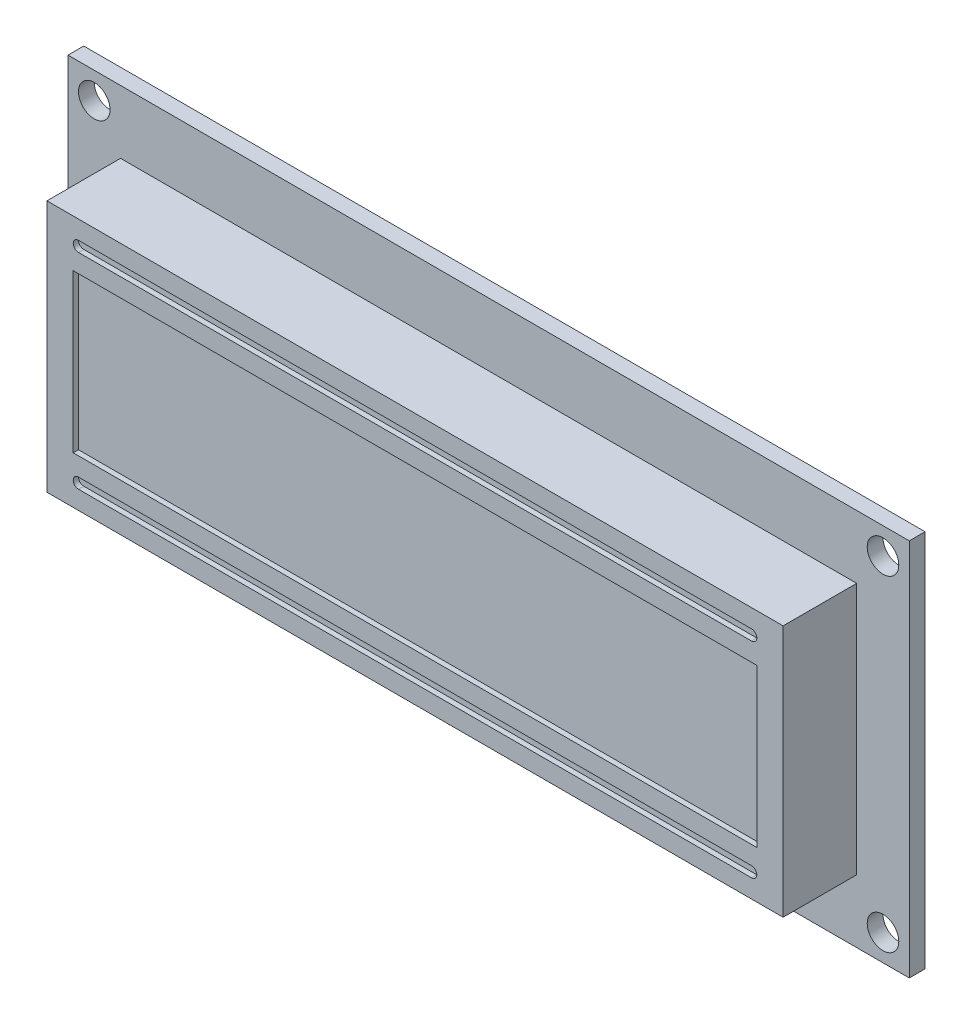
from build123d import *

# Parameters (mm, degrees)
SKETCH1_W           = 80
SKETCH1_H           = 36
BASE_FLANGE1_DEPTH  = 1.5
SKETCH6_W           = 70
SKETCH6_H           = 24
BOSS_EXTRUDE1_DEPTH = 7
SKETCH7_W           = 65
SKETCH7_H           = 15
CUT_EXTRUDE1_DEPTH  = 0.5
CUT_EXTRUDE2_DEPTH  = 0.5
CUT_EXTRUDE3_REACH  = 46.679
SKETCH9_R           = 1.5


# Sheet-metal steps are written as plain solids
with BuildPart() as part:
    # Sketch1 → Base-Flange1 (new body)
    with BuildSketch(Plane.XY):
        Rectangle(SKETCH1_W, SKETCH1_H)
    extrude(amount=-BASE_FLANGE1_DEPTH)

    # Sketch6 → Boss-Extrude1 (add)
    with BuildSketch(Plane.XY):
        Rectangle(SKETCH6_W, SKETCH6_H)
    extrude(amount=BOSS_EXTRUDE1_DEPTH)

    # Sketch7 → Cut-Extrude1 (cut)
    with BuildSketch(Plane.XY.offset(7)):
        Rectangle(SKETCH7_W, SKETCH7_H)
    extrude(amount=-CUT_EXTRUDE1_DEPTH, mode=Mode.SUBTRACT)

    # Sketch8 → Cut-Extrude2 (cut)
    with BuildSketch(Plane.XY.offset(7)):
        with BuildLine():
            Line((32, 9.25), (-32, 9.25))
            ThreePointArc((-32, 9.25), (-32.5, 9.75), (-32, 10.25))
            Line((-32, 10.25), (32, 10.25))
            ThreePointArc((32, 10.25), (32.5, 9.75), (32, 9.25))
        make_face()
        with BuildLine():
            Line((32, -9.25), (-32, -9.25))
            ThreePointArc((-32, -9.25), (-32.5, -9.75), (-32, -10.25))
            Line((-32, -10.25), (32, -10.25))
            ThreePointArc((32, -10.25), (32.5, -9.75), (32, -9.25))
        make_face()
    extrude(amount=-CUT_EXTRUDE2_DEPTH, mode=Mode.SUBTRACT)

    # Sketch9 → Cut-Extrude3 (cut, up to next)
    with BuildSketch(Plane(origin=(0, 0, -1.5), x_dir=(-1, 0, 0), z_dir=(0, 0, -1)), mode=Mode.PRIVATE) as cut_extrude3_sk1:
        with Locations((-37.5, 15.5)):
            Circle(SKETCH9_R)
    cut_extrude3_tool1 = extrude(cut_extrude3_sk1.sketch, amount=-CUT_EXTRUDE3_REACH, mode=Mode.PRIVATE) & part.part
    # Sketch9 → Cut-Extrude3 (cut, up to next)
    with BuildSketch(Plane(origin=(0, 0, -1.5), x_dir=(-1, 0, 0), z_dir=(0, 0, -1)), mode=Mode.PRIVATE) as cut_extrude3_sk2:
        with Locations((-37.5, -15.5)):
            Circle(SKETCH9_R)
    cut_extrude3_tool2 = extrude(cut_extrude3_sk2.sketch, amount=-CUT_EXTRUDE3_REACH, mode=Mode.PRIVATE) & part.part
    # Sketch9 → Cut-Extrude3 (cut, up to next)
    with BuildSketch(Plane(origin=(0, 0, -1.5), x_dir=(-1, 0, 0), z_dir=(0, 0, -1)), mode=Mode.PRIVATE) as cut_extrude3_sk3:
        with Locations((37.5, 15.5)):
            Circle(SKETCH9_R)
    cut_extrude3_tool3 = extrude(cut_extrude3_sk3.sketch, amount=-CUT_EXTRUDE3_REACH, mode=Mode.PRIVATE) & part.part
    # Sketch9 → Cut-Extrude3 (cut, up to next)
    with BuildSketch(Plane(origin=(0, 0, -1.5), x_dir=(-1, 0, 0), z_dir=(0, 0, -1)), mode=Mode.PRIVATE) as cut_extrude3_sk4:
        with Locations((37.5, -15.5)):
            Circle(SKETCH9_R)
    cut_extrude3_tool4 = extrude(cut_extrude3_sk4.sketch, amount=-CUT_EXTRUDE3_REACH, mode=Mode.PRIVATE) & part.part
    add(cut_extrude3_tool1.solids().sort_by_distance((37.5, 15.5, -1.5))[0], mode=Mode.SUBTRACT)
    add(cut_extrude3_tool2.solids().sort_by_distance((37.5, -15.5, -1.5))[0], mode=Mode.SUBTRACT)
    add(cut_extrude3_tool3.solids().sort_by_distance((-37.5, 15.5, -1.5))[0], mode=Mode.SUBTRACT)
    add(cut_extrude3_tool4.solids().sort_by_distance((-37.5, -15.5, -1.5))[0], mode=Mode.SUBTRACT)


solid = part.part
